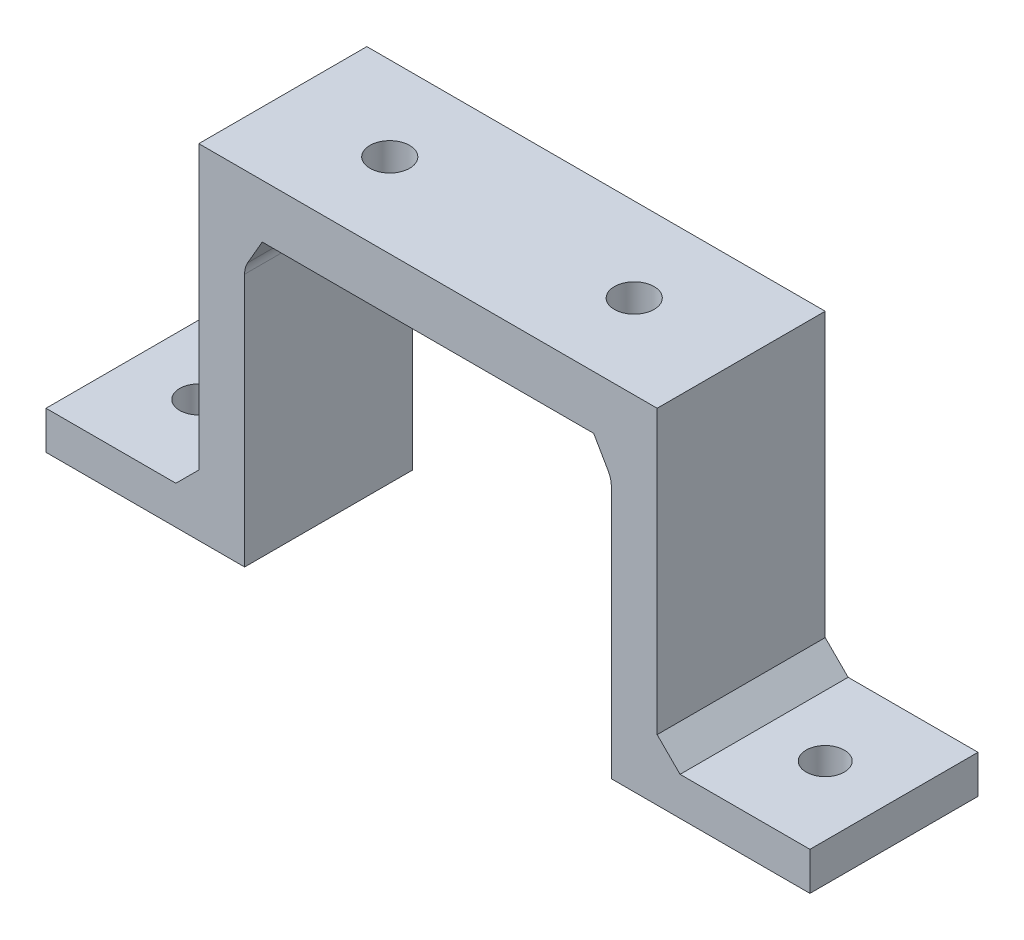
from build123d import *

# Parameters (mm, degrees)
BOSS_EXTRUDE1_DEPTH = 22
SKETCH2_R           = 2.6
CUT_EXTRUDE1_DEPTH  = 20
SKETCH3_R           = 2.5
CUT_EXTRUDE2_DEPTH  = 20
CHAMFER1_SIZE       = 4
CHAMFER1_SIZE2      = 2.309401077
CHAMFER2_SIZE       = 4
CHAMFER2_SIZE2      = 2.309401077
FILLET2_R           = 3
CHAMFER3_SIZE       = 3


with BuildPart() as part:
    # Sketch1 → Boss-Extrude1 (new body)
    with BuildSketch(Plane.XY):
        Polygon((30, 33.76443418), (-30, 33.76443418), (-30, -6.23556582), (-50, -6.23556582), (-50, -11.23556582), (-24, -11.23556582), (-24, 26.76443418), (24, 26.76443418), (24, -11.23556582), (50, -11.23556582), (50, -6.23556582), (30, -6.23556582), align=None)
    extrude(amount=BOSS_EXTRUDE1_DEPTH)

    # Sketch2 → Cut-Extrude1 (cut)
    with BuildSketch(Plane(origin=(0, 33.76443418, 0), x_dir=(1, 0, 0), z_dir=(0, 1, 0))):
        with Locations((-16, -11)):
            Circle(SKETCH2_R)
        with Locations((16, -11)):
            Circle(SKETCH2_R)
    extrude(amount=-CUT_EXTRUDE1_DEPTH, mode=Mode.SUBTRACT)

    # Sketch3 → Cut-Extrude2 (cut)
    with BuildSketch(Plane(origin=(0, -6.23556582, 0), x_dir=(1, 0, 0), z_dir=(0, 1, 0))):
        with Locations((-41, -11)):
            Circle(SKETCH3_R)
    cut_extrude2 = extrude(amount=-CUT_EXTRUDE2_DEPTH, mode=Mode.SUBTRACT)

    # Mirror1: Cut-Extrude2 across plane
    add(cut_extrude2.mirror(Plane(origin=(0, 0, 0), x_dir=(0, 0, 1), z_dir=(1, 0, 0))), mode=Mode.SUBTRACT)

    # Chamfer1
    chamfer1_edges = [part.edges().sort_by_distance(p)[0] for p in [
        (-24, 26.76443418, 11),
    ]]
    chamfer1_side = [part.faces().sort_by_distance(p)[0] for p in [
        (-24, 7.76443418, 11),
    ]]
    chamfer(chamfer1_edges, length=CHAMFER1_SIZE, length2=CHAMFER1_SIZE2, reference=chamfer1_side[0])

    # Chamfer2
    chamfer2_edges = [part.edges().sort_by_distance(p)[0] for p in [
        (24, 26.76443418, 11),
    ]]
    chamfer2_side = [part.faces().sort_by_distance(p)[0] for p in [
        (24, 7.76443418, 11),
    ]]
    chamfer(chamfer2_edges, length=CHAMFER2_SIZE, length2=CHAMFER2_SIZE2, reference=chamfer2_side[0])

    # Fillet2
    fillet2_edges = [part.edges().sort_by_distance(p)[0] for p in [
        (24, 22.76443418, 11),
        (-24, 22.76443418, 11),
    ]]
    fillet(fillet2_edges, radius=FILLET2_R)

    # Chamfer3
    chamfer3_edges = [part.edges().sort_by_distance(p)[0] for p in [
        (-30, -6.23556582, 11),
        (30, -6.23556582, 11),
    ]]
    chamfer(chamfer3_edges, length=CHAMFER3_SIZE)


solid = part.part
